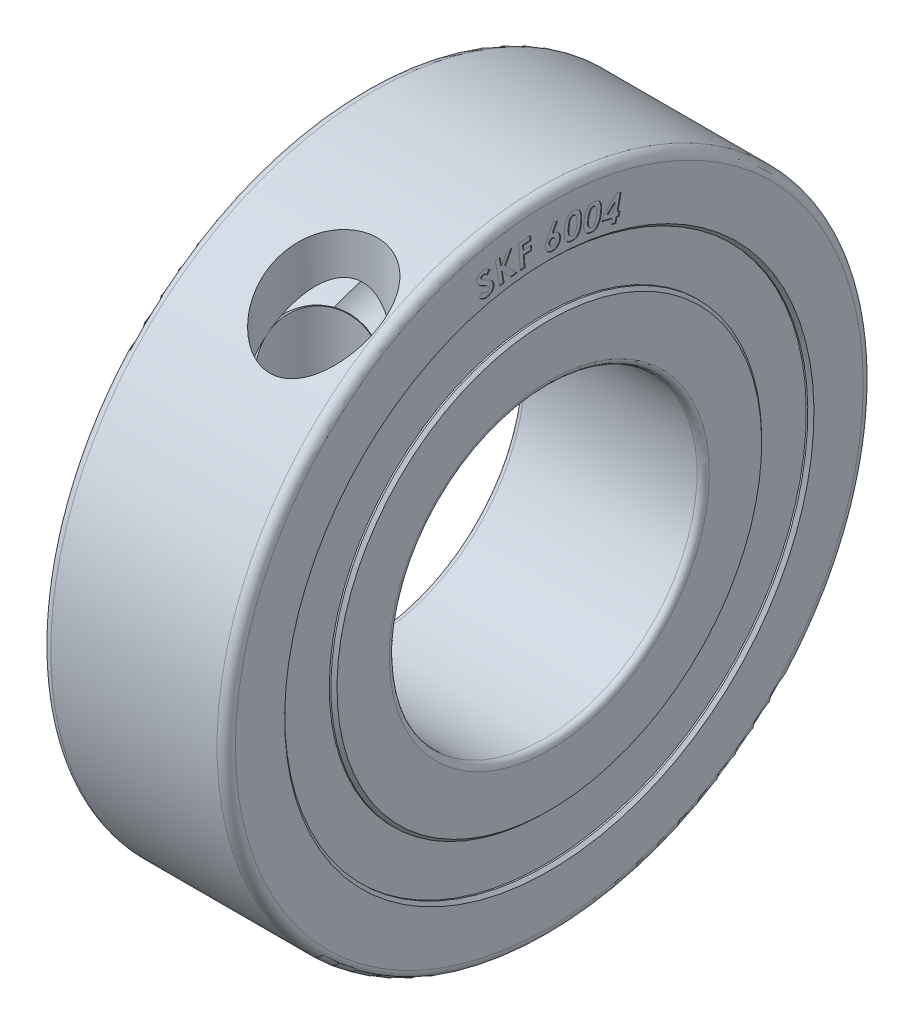
from build123d import *

# Parameters (mm, degrees)
CIRPATTERN1_COUNT  = 10
WRAP1_START        = -0.05
WRAP1_DEPTH        = 0.05
SKETCH6_R          = 17
SKETCH6_R_2        = 14
SEAL_1_DEPTH       = 0.2
SKETCH7_R          = 17
SKETCH7_R_2        = 14
SEAL_2_DEPTH       = 0.2
SKETCH10_R         = 3.500000003
CUT_EXTRUDE2_DEPTH = 80


# Read off the part's stored shape, not the designer's step: Wrap1
with BuildPart() as part:
    # Sketch1 → Revolve1 (revolve)
    with BuildSketch(Plane.XY):
        with BuildLine():
            ThreePointArc((-8.598076211, 14), (-6, 12.5), (-3.401923789, 14))
            Line((-3.401923789, 14), (-0.2, 14))
            Line((-0.2, 14), (0, 13.8))
            Line((0, 13.8), (0, 10.4))
            ThreePointArc((0, 10.4), (-0.117157288, 10.117157288), (-0.4, 10))
            Line((-0.4, 10), (-11.6, 10))
            ThreePointArc((-11.6, 10), (-11.882842712, 10.117157288), (-12, 10.4))
            Line((-12, 10.4), (-12, 13.8))
            Line((-12, 13.8), (-11.8, 14))
            Line((-11.8, 14), (-8.598076211, 14))
        make_face()
        with BuildLine():
            ThreePointArc((-12, 20.4), (-11.824264069, 20.824264069), (-11.4, 21))
            Line((-11.4, 21), (-0.6, 21))
            ThreePointArc((-0.6, 21), (-0.175735931, 20.824264069), (0, 20.4))
            Line((0, 20.4), (0, 17.2))
            Line((0, 17.2), (-0.2, 17))
            Line((-0.2, 17), (-3.401923789, 17))
            ThreePointArc((-3.401923789, 17), (-6, 18.5), (-8.598076211, 17))
            Line((-8.598076211, 17), (-11.8, 17))
            Line((-11.8, 17), (-12, 17.2))
            Line((-12, 17.2), (-12, 20.4))
        make_face()
    revolve(axis=Axis((0, 0, 0), (-1, 0, 0)))

    # Wrap1 outline → Wrap1 (cut)
    # profile 1 of 7: a face of its own
    with BuildSketch(Plane(origin=(0, 0, 0), x_dir=(0, 0, -1), z_dir=(1, 0, 0)).offset(WRAP1_START)):
        with BuildLine():
            add(Edge.make_bspline(
                [(3.371230073, 18.099908799), (3.367021792, 18.074450646), (3.358845885, 18.024990187), (3.344100531, 17.953462082), (3.327675767, 17.886692452), (3.310287168, 17.824463326), (3.291023357, 17.76706186), (3.270562573, 17.714251275), (3.248651952, 17.666050883), (3.224600442, 17.622647963), (3.200020082, 17.582877045), (3.173672712, 17.546918509), (3.147123316, 17.513492758), (3.118931042, 17.483621607), (3.090310833, 17.456494062), (3.060045379, 17.433023031), (3.029231176, 17.412018677), (2.9967952, 17.394666952), (2.963356804, 17.380162765), (2.92851016, 17.368545), (2.892249335, 17.359943276), (2.854416962, 17.354143708), (2.815081223, 17.351301149), (2.774190372, 17.351515165), (2.731850469, 17.353773642), (2.703363248, 17.358008783), (2.688858278, 17.360165209)],
                knots=[0, 0, 0, 0, 0.06771507, 0.131557793, 0.191605808, 0.24814466, 0.301078439, 0.350439304, 0.396733745, 0.439899694, 0.480587711, 0.519343045, 0.556826925, 0.592534191, 0.627052559, 0.660202326, 0.692941642, 0.724807233, 0.756580172, 0.788499994, 0.821075612, 0.854266855, 0.888846663, 0.924455818, 0.96153482, 1, 1, 1, 1], degree=3))
            add(Edge.make_bspline(
                [(2.945589047, 19.017216491), (2.959740171, 19.014769669), (2.987509021, 19.009968252), (3.027771436, 18.999031871), (3.066267586, 18.98652646), (3.102652231, 18.970840473), (3.137407792, 18.953359805), (3.170073744, 18.933141236), (3.200793446, 18.910476097), (3.229585385, 18.885575603), (3.256452955, 18.858079923), (3.281060855, 18.82808068), (3.303212811, 18.795332489), (3.323587507, 18.760469683), (3.341019583, 18.722644074), (3.356875377, 18.682722618), (3.369869534, 18.639983587), (3.381209546, 18.594794272), (3.389970077, 18.546204418), (3.395472187, 18.493930855), (3.398720388, 18.437776925), (3.398909178, 18.37776587), (3.396257572, 18.313824388), (3.390736346, 18.24594039), (3.382340924, 18.174125334), (3.375001883, 18.125103154), (3.371230073, 18.099908799)],
                knots=[0, 0, 0, 0, 0.037515201, 0.073616341, 0.108937968, 0.143221105, 0.177064726, 0.210542334, 0.243494071, 0.276750842, 0.309925447, 0.343856508, 0.378013179, 0.413168846, 0.449269985, 0.486761276, 0.525358336, 0.565926344, 0.60848579, 0.65427892, 0.703225985, 0.755444982, 0.811059021, 0.870448349, 0.933418499, 1, 1, 1, 1], degree=3))
            add(Edge.make_bspline(
                [(2.496550585, 18.869780594), (2.511904799, 18.884820046), (2.54196111, 18.914260201), (2.592272883, 18.950876921), (2.644728086, 18.980794925), (2.700034823, 19.003077589), (2.757908698, 19.017968897), (2.818434768, 19.025100066), (2.881511985, 19.02573228), (2.923940727, 19.020093535), (2.945589047, 19.017216491)],
                knots=[0, 0, 0, 0, 0.13062355, 0.25569931, 0.377370497, 0.497237959, 0.617378322, 0.73985433, 0.867266468, 1, 1, 1, 1], degree=3))
            add(Edge.make_bspline(
                [(2.261935201, 18.261767773), (2.267913747, 18.296659865), (2.279443406, 18.36394946), (2.301371478, 18.460298368), (2.325733324, 18.548707562), (2.353636925, 18.628970664), (2.384037943, 18.701454074), (2.418211668, 18.765467486), (2.454529946, 18.822015713), (2.482908489, 18.854273617), (2.496550585, 18.869780594)],
                knots=[0, 0, 0, 0, 0.160750525, 0.310008292, 0.448575007, 0.577014696, 0.695710594, 0.805112842, 0.906314099, 1, 1, 1, 1], degree=3))
            add(Edge.make_bspline(
                [(2.688858278, 17.360165209), (2.674398915, 17.362766288), (2.645935262, 17.367886582), (2.604688734, 17.378439473), (2.565641757, 17.391381705), (2.528642479, 17.406270264), (2.494086771, 17.424067653), (2.461367669, 17.443642402), (2.430949786, 17.465667383), (2.402948684, 17.490329148), (2.376750031, 17.516899164), (2.353148256, 17.546308877), (2.33109988, 17.577729578), (2.311719339, 17.612054475), (2.293591406, 17.648356351), (2.278397802, 17.687422163), (2.264883657, 17.728604311), (2.253187723, 17.77240871), (2.244172575, 17.819620095), (2.238189507, 17.87071104), (2.235226074, 17.925933062), (2.23441464, 17.985192468), (2.237388884, 18.048583582), (2.242290312, 18.116075511), (2.250888153, 18.187652297), (2.258179738, 18.236572093), (2.261935201, 18.261767773)],
                knots=[0, 0, 0, 0, 0.038840046, 0.076457701, 0.112461119, 0.147558653, 0.18179863, 0.215132686, 0.248303527, 0.280939506, 0.313703624, 0.346839559, 0.380537958, 0.415088877, 0.450971274, 0.487746736, 0.525805242, 0.565550214, 0.607548685, 0.652787717, 0.701461887, 0.753729716, 0.809430509, 0.869211738, 0.932638737, 1, 1, 1, 1], degree=3))
        make_face()
        with BuildLine():
            add(Edge.make_bspline(
                [(2.560973662, 18.207601107), (2.55722818, 18.183591837), (2.55003775, 18.137499774), (2.543190741, 18.070731306), (2.538756312, 18.009488354), (2.537625385, 17.953625995), (2.539847826, 17.903211609), (2.544600245, 17.858006135), (2.553109689, 17.818241148), (2.564811559, 17.783579123), (2.578994779, 17.753391663), (2.595527488, 17.727047089), (2.613358453, 17.703637369), (2.633512942, 17.683910786), (2.655372808, 17.667283823), (2.679381127, 17.654562816), (2.705018666, 17.644470059), (2.723179696, 17.641068058), (2.732448021, 17.639331876)],
                knots=[0, 0, 0, 0, 0.11048341, 0.212101753, 0.305111828, 0.389660501, 0.466013113, 0.534473427, 0.596129147, 0.650517161, 0.700502016, 0.747417632, 0.791733032, 0.833989916, 0.875286291, 0.916154624, 0.957210235, 1, 1, 1, 1], degree=3))
            add(Edge.make_bspline(
                [(2.907448021, 18.731319055), (2.894964081, 18.732735738), (2.870401693, 18.735523089), (2.833372658, 18.731784978), (2.797826868, 18.721203827), (2.76937118, 18.707672013), (2.747556151, 18.693256505), (2.731752717, 18.679714116), (2.716100269, 18.664253396), (2.701416517, 18.646045889), (2.687027584, 18.625619461), (2.673324639, 18.602692161), (2.659840379, 18.577724589), (2.64683592, 18.550186274), (2.634802884, 18.519589276), (2.622871741, 18.48572158), (2.611279712, 18.448229827), (2.600785076, 18.406918191), (2.589440149, 18.362317842), (2.580008866, 18.313834182), (2.569754695, 18.26200592), (2.563960116, 18.226104336), (2.560973662, 18.207601107)],
                knots=[0, 0, 0, 0, 0.053807152, 0.105866591, 0.158396439, 0.212334335, 0.240439985, 0.270382042, 0.301508468, 0.334738855, 0.37061322, 0.408674434, 0.449295614, 0.49237112, 0.539287623, 0.590335628, 0.64646645, 0.70763757, 0.773253033, 0.843935961, 0.919566535, 1, 1, 1, 1], degree=3))
            add(Edge.make_bspline(
                [(3.071871098, 18.144460081), (3.075684523, 18.169328645), (3.08301762, 18.217150114), (3.090678084, 18.286327778), (3.095392758, 18.349945426), (3.096631485, 18.407812309), (3.095472971, 18.460088149), (3.090298234, 18.506580948), (3.082619946, 18.547678003), (3.071379185, 18.583361008), (3.057208649, 18.614283936), (3.041695788, 18.641546984), (3.024196126, 18.665472244), (3.004599818, 18.685634127), (2.983229783, 18.702798813), (2.959564932, 18.715725476), (2.934407127, 18.726202463), (2.916511124, 18.729598961), (2.907448021, 18.731319055)],
                knots=[0, 0, 0, 0, 0.111921973, 0.21522245, 0.309570358, 0.395623902, 0.472662068, 0.542001484, 0.603525321, 0.65839315, 0.707958574, 0.754593049, 0.797752856, 0.839434739, 0.879372757, 0.919169101, 0.959064669, 1, 1, 1, 1], degree=3))
            add(Edge.make_bspline(
                [(2.923473662, 17.719460081), (2.931745653, 17.730072864), (2.94915253, 17.752405505), (2.97116286, 17.791330103), (2.99197335, 17.835854085), (3.011507892, 17.886139473), (3.028801764, 17.942494273), (3.045333601, 18.004425744), (3.059477642, 18.072443833), (3.067637857, 18.119861441), (3.071871098, 18.144460081)],
                knots=[0, 0, 0, 0, 0.088647822, 0.186542965, 0.294033778, 0.412723239, 0.541986475, 0.682654909, 0.835372178, 1, 1, 1, 1], degree=3))
            add(Edge.make_bspline(
                [(2.732448021, 17.639331876), (2.741408215, 17.638222221), (2.758975574, 17.63604663), (2.785305096, 17.6371819), (2.810839087, 17.641522682), (2.835391637, 17.650082494), (2.85901233, 17.662040721), (2.881563278, 17.677759743), (2.903633717, 17.696659594), (2.916714474, 17.711692278), (2.923473662, 17.719460081)],
                knots=[0, 0, 0, 0, 0.124271779, 0.243647278, 0.36180831, 0.480106935, 0.600639691, 0.725642384, 0.858231852, 1, 1, 1, 1], degree=3))
        make_face(mode=Mode.SUBTRACT)
    # profile 2 of 7: a face of its own
    with BuildSketch(Plane(origin=(0, 0, 0), x_dir=(0, 0, -1), z_dir=(1, 0, 0)).offset(WRAP1_START)):
        with BuildLine():
            add(Edge.make_bspline(
                [(2.095342211, 18.297444026), (2.09291739, 18.27178867), (2.088201899, 18.221897314), (2.079035438, 18.149492619), (2.067695358, 18.081646292), (2.055127245, 18.018273359), (2.040452476, 17.959519487), (2.023753498, 17.905378374), (2.005319152, 17.855790432), (1.98502908, 17.810518082), (1.962959724, 17.76928126), (1.940043214, 17.731054821), (1.915612255, 17.696139217), (1.890262865, 17.664013872), (1.863230797, 17.635329769), (1.835420807, 17.608972218), (1.805757408, 17.586378476), (1.77515845, 17.566180503), (1.742939362, 17.549178878), (1.709074408, 17.5349231), (1.673379767, 17.523874559), (1.636135795, 17.515087655), (1.597092063, 17.509459669), (1.556414384, 17.506228156), (1.513883244, 17.50586), (1.485077179, 17.507925789), (1.470342211, 17.508982488)],
                knots=[0, 0, 0, 0, 0.067634643, 0.131527465, 0.19150296, 0.248146273, 0.301058101, 0.350372437, 0.396779637, 0.439829112, 0.480472474, 0.519474004, 0.556735109, 0.592251312, 0.626772806, 0.660105342, 0.692692356, 0.724502796, 0.756238993, 0.788162936, 0.820799379, 0.854196724, 0.888500003, 0.924222611, 0.961238115, 1, 1, 1, 1], degree=3))
            add(Edge.make_bspline(
                [(1.601752468, 19.181097872), (1.615994103, 19.179727766), (1.644092972, 19.177024535), (1.685131719, 19.169004114), (1.72460147, 19.159257331), (1.762315833, 19.146833481), (1.79793309, 19.131204616), (1.832095943, 19.113621008), (1.864535147, 19.09344593), (1.895072154, 19.070468776), (1.924115468, 19.045282075), (1.950649195, 19.016807537), (1.975458979, 18.986064521), (1.99786595, 18.9524849), (2.018511911, 18.916432893), (2.036971867, 18.877584771), (2.053766418, 18.83612491), (2.068171703, 18.791668823), (2.080378947, 18.743826746), (2.090380366, 18.692273775), (2.097152413, 18.636460305), (2.101985625, 18.576693197), (2.104156767, 18.512630722), (2.103609111, 18.444540812), (2.101298812, 18.372255445), (2.097365808, 18.322859212), (2.095342211, 18.297444026)],
                knots=[0, 0, 0, 0, 0.03735056, 0.073692972, 0.109090982, 0.143507382, 0.177255438, 0.210580872, 0.243799811, 0.276896621, 0.310315398, 0.344072683, 0.378415464, 0.413399656, 0.449397582, 0.486842889, 0.525656602, 0.566162923, 0.608803755, 0.654558023, 0.703224562, 0.755576787, 0.811144487, 0.870585365, 0.93341401, 1, 1, 1, 1], degree=3))
            add(Edge.make_bspline(
                [(1.165214006, 18.999687616), (1.179369198, 19.015864951), (1.207105955, 19.047564049), (1.254417581, 19.088141221), (1.304665172, 19.121732705), (1.357983235, 19.148460584), (1.414710953, 19.167273505), (1.47438275, 19.179620528), (1.537288743, 19.184386081), (1.579961607, 19.182209395), (1.601752468, 19.181097872)],
                knots=[0, 0, 0, 0, 0.130620006, 0.255946758, 0.377787921, 0.497526061, 0.617540752, 0.740274638, 0.867371473, 1, 1, 1, 1], degree=3))
            add(Edge.make_bspline(
                [(0.976431955, 18.375969667), (0.979714821, 18.411159795), (0.986059186, 18.479167159), (1.000908033, 18.57691839), (1.018993788, 18.666938967), (1.040598245, 18.749110441), (1.065736792, 18.823461978), (1.094591467, 18.889914616), (1.126791338, 18.94888655), (1.152733277, 18.983186045), (1.165214006, 18.999687616)],
                knots=[0, 0, 0, 0, 0.160494637, 0.31016702, 0.448821292, 0.57735073, 0.695815233, 0.804898528, 0.906136206, 1, 1, 1, 1], degree=3))
            add(Edge.make_bspline(
                [(1.470342211, 17.508982488), (1.455682424, 17.510514806), (1.426991218, 17.513513763), (1.385003119, 17.520949134), (1.345075793, 17.53084798), (1.306998371, 17.54300862), (1.271034775, 17.557688308), (1.237129061, 17.575207375), (1.205148008, 17.594973282), (1.175103307, 17.617245754), (1.1471017, 17.642009337), (1.121113676, 17.669488749), (1.096614586, 17.699178949), (1.074602156, 17.731909744), (1.053906178, 17.766736567), (1.035808539, 17.804542699), (1.019070783, 17.844606297), (1.004176421, 17.887571271), (0.99161335, 17.934015629), (0.981806569, 17.98447334), (0.974472351, 18.039268408), (0.969828846, 18.09832764), (0.967604656, 18.161742717), (0.968171162, 18.229300899), (0.970485277, 18.301264483), (0.974408851, 18.350554409), (0.976431955, 18.375969667)],
                knots=[0, 0, 0, 0, 0.038949878, 0.07623023, 0.112597827, 0.147604629, 0.181795547, 0.215137477, 0.248363209, 0.281063993, 0.313871897, 0.347027956, 0.380943726, 0.415485019, 0.451178704, 0.487930185, 0.526160964, 0.565901269, 0.608029874, 0.653220521, 0.701663576, 0.7540765, 0.809741728, 0.869325926, 0.932620807, 1, 1, 1, 1], degree=3))
        make_face()
        with BuildLine():
            add(Edge.make_bspline(
                [(1.278996058, 18.344238898), (1.277224785, 18.320103253), (1.273818157, 18.273683988), (1.271607313, 18.206650494), (1.271679586, 18.145264564), (1.274771084, 18.089391782), (1.28073669, 18.039281684), (1.289163788, 17.99460862), (1.300616301, 17.955609833), (1.314689063, 17.921814575), (1.331412309, 17.892959551), (1.349410162, 17.867598703), (1.369171758, 17.845801079), (1.390714267, 17.827483734), (1.413711076, 17.812624998), (1.438632685, 17.801655377), (1.465005467, 17.793713493), (1.483431098, 17.791510357), (1.492778109, 17.790392744)],
                knots=[0, 0, 0, 0, 0.110050834, 0.211657022, 0.304947548, 0.38914537, 0.465985354, 0.534308319, 0.595646897, 0.650514953, 0.70035513, 0.747009881, 0.791721547, 0.833777677, 0.875291416, 0.915745251, 0.95725899, 1, 1, 1, 1], degree=3))
            add(Edge.make_bspline(
                [(1.585406314, 18.892636334), (1.572892944, 18.89305767), (1.548124364, 18.89389165), (1.511373089, 18.887741983), (1.476665024, 18.874393928), (1.449218401, 18.858893772), (1.428830779, 18.84257319), (1.413612411, 18.828248461), (1.39975758, 18.811043682), (1.386043483, 18.792022818), (1.373406454, 18.770465042), (1.361120067, 18.746792883), (1.350133852, 18.720593844), (1.338939308, 18.692334175), (1.329115948, 18.660903341), (1.319782631, 18.626159584), (1.311324878, 18.587842051), (1.303126043, 18.545991153), (1.296447361, 18.500582703), (1.289429997, 18.451709311), (1.283852546, 18.399199719), (1.280648568, 18.36294034), (1.278996058, 18.344238898)],
                knots=[0, 0, 0, 0, 0.05362201, 0.106137761, 0.158491276, 0.212495803, 0.240553822, 0.27037554, 0.301945594, 0.335137331, 0.370900023, 0.40902506, 0.449465365, 0.492702034, 0.53937298, 0.590623594, 0.64699545, 0.70766716, 0.773523293, 0.843847779, 0.919461618, 1, 1, 1, 1], degree=3))
            add(Edge.make_bspline(
                [(1.793098622, 18.319559411), (1.794974187, 18.344656333), (1.798578832, 18.39289004), (1.801117367, 18.462485113), (1.801350231, 18.526215222), (1.798619773, 18.584115386), (1.792924081, 18.636030621), (1.784860698, 18.682193168), (1.773753508, 18.722477167), (1.759957285, 18.757316653), (1.743551568, 18.787126973), (1.726081932, 18.813304385), (1.706666833, 18.835673023), (1.685713524, 18.854484162), (1.663010526, 18.869827551), (1.638590939, 18.881363293), (1.612539513, 18.889296061), (1.594538005, 18.891512163), (1.585406314, 18.892636334)],
                knots=[0, 0, 0, 0, 0.111925396, 0.215109112, 0.309669572, 0.395308495, 0.472761083, 0.541825581, 0.603507297, 0.658303399, 0.70805889, 0.754582693, 0.798032276, 0.839427361, 0.879491956, 0.919452154, 0.959140201, 1, 1, 1, 1], degree=3))
            add(Edge.make_bspline(
                [(1.677393493, 17.884944026), (1.684794236, 17.896233375), (1.700296021, 17.919880336), (1.719719034, 17.960151403), (1.736730981, 18.006079098), (1.752147333, 18.057684045), (1.765377767, 18.114988823), (1.776858766, 18.178094761), (1.786512354, 18.246839817), (1.790851621, 18.29475007), (1.793098622, 18.319559411)],
                knots=[0, 0, 0, 0, 0.089049784, 0.186525971, 0.294345853, 0.412174039, 0.541864021, 0.682428905, 0.835552332, 1, 1, 1, 1], degree=3))
            add(Edge.make_bspline(
                [(1.492778109, 17.790392744), (1.501759263, 17.789888941), (1.519464092, 17.78889578), (1.545555148, 17.7924326), (1.570590625, 17.798803251), (1.594592653, 17.808741113), (1.617040131, 17.822926205), (1.638834664, 17.839920119), (1.658954917, 17.861025093), (1.671127121, 17.876815148), (1.677393493, 17.884944026)],
                knots=[0, 0, 0, 0, 0.12364208, 0.243739497, 0.360805692, 0.478866487, 0.599754619, 0.725463477, 0.858665841, 1, 1, 1, 1], degree=3))
        make_face(mode=Mode.SUBTRACT)
    # profile 3 of 7: a face of its own
    with BuildSketch(Plane(origin=(0, 0, 0), x_dir=(0, 0, -1), z_dir=(1, 0, 0)).offset(WRAP1_START)):
        with BuildLine():
            add(Edge.make_bspline(
                [(0.247749873, 18.572715831), (0.264337421, 18.572090536), (0.296926565, 18.570862035), (0.344820026, 18.563259573), (0.390697017, 18.551315349), (0.435027206, 18.535550411), (0.476745201, 18.513951528), (0.516801872, 18.488481744), (0.555047326, 18.45867384), (0.590567377, 18.424347003), (0.62356237, 18.387413872), (0.651828913, 18.347244078), (0.676091853, 18.305172276), (0.695630749, 18.260759778), (0.710835616, 18.214283333), (0.721329904, 18.165633482), (0.727601775, 18.114763993), (0.727997238, 18.080105847), (0.728198591, 18.062459421)],
                knots=[0, 0, 0, 0, 0.063700778, 0.125151336, 0.185753709, 0.245588764, 0.30540553, 0.365728104, 0.427692868, 0.491244168, 0.555198125, 0.617582535, 0.679514692, 0.741418303, 0.803566165, 0.866980907, 0.932272443, 1, 1, 1, 1], degree=3))
            Line((0.247749873, 18.572715831), (0.531403719, 19.110856857))
            Line((0.531403719, 19.110856857), (0.275313975, 19.242267113))
            Line((0.275313975, 19.242267113), (-0.141993717, 18.445792754))
            add(Edge.make_bspline(
                [(-0.270198845, 18.069510703), (-0.269857774, 18.081808834), (-0.269170498, 18.106590262), (-0.264593868, 18.143685004), (-0.25697304, 18.18076282), (-0.248911875, 18.21213646), (-0.239786099, 18.23840267), (-0.231650945, 18.260907659), (-0.220764999, 18.285493855), (-0.208616432, 18.312748214), (-0.194915959, 18.342704076), (-0.178780135, 18.374817398), (-0.161173639, 18.409607388), (-0.148551525, 18.433420614), (-0.141993717, 18.445792754)],
                knots=[0, 0, 0, 0, 0.091812954, 0.185008287, 0.278551124, 0.374322003, 0.426534136, 0.486094508, 0.552913929, 0.627178303, 0.708902245, 0.798792991, 0.895463084, 1, 1, 1, 1], degree=3))
            add(Edge.make_bspline(
                [(0.226596027, 17.571113267), (0.209045321, 17.571717578), (0.174417747, 17.572909884), (0.123761703, 17.580835325), (0.075338513, 17.592991743), (0.029193911, 17.609699437), (-0.01462895, 17.631191931), (-0.055833114, 17.657908362), (-0.095178353, 17.688611065), (-0.13125384, 17.724067158), (-0.163919317, 17.762312793), (-0.193187926, 17.801975517), (-0.217011577, 17.843604474), (-0.237369544, 17.886038354), (-0.252307696, 17.930110527), (-0.262876061, 17.975410978), (-0.269675151, 18.021973319), (-0.270023216, 18.053568272), (-0.270198845, 18.069510703)],
                knots=[0, 0, 0, 0, 0.067328577, 0.1328394, 0.196270313, 0.258644694, 0.320792365, 0.383106101, 0.446743311, 0.511967507, 0.576793738, 0.639601694, 0.700769614, 0.760550994, 0.8199234, 0.878885421, 0.938887048, 1, 1, 1, 1], degree=3))
            add(Edge.make_bspline(
                [(0.728198591, 18.062459421), (0.727578074, 18.045443245), (0.726358566, 18.012001152), (0.71868307, 17.962861084), (0.707060598, 17.91575885), (0.69037213, 17.87074517), (0.669695811, 17.827580374), (0.643658564, 17.786849076), (0.613766324, 17.747694951), (0.579437603, 17.71138), (0.542081239, 17.678182342), (0.502705634, 17.648769918), (0.461050795, 17.624295532), (0.417644498, 17.604410502), (0.372507767, 17.588736241), (0.325366241, 17.578458155), (0.276585698, 17.571614567), (0.243393615, 17.571281715), (0.226596027, 17.571113267)],
                knots=[0, 0, 0, 0, 0.065323678, 0.128381405, 0.190559154, 0.251291348, 0.312381252, 0.373948514, 0.436546971, 0.501258641, 0.565469168, 0.628228685, 0.689642719, 0.750578196, 0.811285451, 0.872683046, 0.935568438, 1, 1, 1, 1], degree=3))
        make_face()
        with BuildLine():
            add(Edge.make_bspline(
                [(0.026275514, 18.074318395), (0.026751649, 18.05950124), (0.02768021, 18.030604715), (0.039022168, 17.989201734), (0.057674379, 17.951377467), (0.0835563, 17.918223936), (0.114121297, 17.890518551), (0.148247446, 17.869990007), (0.185231038, 17.857210438), (0.21100601, 17.855374453), (0.224031924, 17.8544466)],
                knots=[0, 0, 0, 0, 0.135224471, 0.263715746, 0.389156449, 0.518761666, 0.646106758, 0.764439774, 0.880954771, 1, 1, 1, 1], degree=3))
            add(Edge.make_bspline(
                [(0.227557565, 18.28617737), (0.213897194, 18.285741014), (0.187244271, 18.284889635), (0.149196063, 18.272897524), (0.114307589, 18.254035543), (0.08402332, 18.227330504), (0.058467168, 18.195365365), (0.039935812, 18.158494295), (0.028843604, 18.117573452), (0.027148619, 18.089024347), (0.026275514, 18.074318395)],
                knots=[0, 0, 0, 0, 0.125207775, 0.244294468, 0.363052186, 0.48778071, 0.613034767, 0.737425939, 0.864745266, 1, 1, 1, 1], degree=3))
            add(Edge.make_bspline(
                [(0.431724232, 18.070151729), (0.431231364, 18.084962576), (0.430277971, 18.113612393), (0.419333686, 18.154791097), (0.40070284, 18.191826243), (0.375404591, 18.224568115), (0.344398875, 18.251416303), (0.309017924, 18.271602294), (0.269466579, 18.283794914), (0.241745013, 18.285370838), (0.227557565, 18.28617737)],
                knots=[0, 0, 0, 0, 0.133600665, 0.258434547, 0.381504528, 0.506080469, 0.629980993, 0.749749056, 0.87192563, 1, 1, 1, 1], degree=3))
            add(Edge.make_bspline(
                [(0.224031924, 17.8544466), (0.237682948, 17.85504221), (0.26451443, 17.856212899), (0.303186995, 17.868003243), (0.338794, 17.887335017), (0.370582745, 17.913982621), (0.39762591, 17.946322916), (0.416994863, 17.984010428), (0.429475728, 18.025678957), (0.430957921, 18.054995003), (0.431724232, 18.070151729)],
                knots=[0, 0, 0, 0, 0.122550959, 0.240877457, 0.360032907, 0.484970173, 0.612001885, 0.736702204, 0.863872077, 1, 1, 1, 1], degree=3))
        make_face(mode=Mode.SUBTRACT)
    # profile 4 of 7: a face of its own
    with BuildSketch(Plane(origin=(0, 0, 0), x_dir=(0, 0, -1), z_dir=(1, 0, 0)).offset(WRAP1_START)):
        with BuildLine():
            add(Edge.make_bspline(
                [(-4.028029173, 18.350351868), (-4.040396967, 18.36077367), (-4.064126452, 18.380769475), (-4.100399702, 18.406933466), (-4.135718731, 18.428043061), (-4.17023037, 18.443894671), (-4.203719713, 18.455145751), (-4.236412405, 18.461003436), (-4.268203602, 18.462069788), (-4.288533927, 18.458298241), (-4.298541994, 18.456441611)],
                knots=[0, 0, 0, 0, 0.160850741, 0.308616513, 0.444411743, 0.569490283, 0.685779989, 0.794815753, 0.89899337, 1, 1, 1, 1], degree=3))
            Line((-4.028029173, 18.350351868), (-3.85495225, 18.592980073))
            add(Edge.make_bspline(
                [(-4.359118917, 18.739133919), (-4.339849777, 18.742929028), (-4.301564579, 18.7504694), (-4.243015773, 18.7531928), (-4.184548442, 18.748436957), (-4.13573955, 18.739237692), (-4.096204551, 18.727692036), (-4.065072172, 18.716548522), (-4.032947564, 18.702092729), (-3.999439371, 18.685685543), (-3.964987458, 18.666078468), (-3.929185037, 18.644437656), (-3.892162956, 18.619987311), (-3.867597807, 18.602158119), (-3.85495225, 18.592980073)],
                knots=[0, 0, 0, 0, 0.108281815, 0.215141445, 0.322188001, 0.431471833, 0.488574182, 0.549380289, 0.613801409, 0.682891906, 0.755227605, 0.832488319, 0.913768956, 1, 1, 1, 1], degree=3))
            add(Edge.make_bspline(
                [(-4.694054814, 18.250031355), (-4.696655171, 18.263346758), (-4.701783862, 18.28960876), (-4.7050657, 18.329252298), (-4.703750311, 18.368275776), (-4.698153641, 18.406696424), (-4.6888981, 18.444647667), (-4.67540159, 18.482119463), (-4.657065498, 18.51868153), (-4.635601806, 18.554683364), (-4.610450725, 18.588686135), (-4.582467431, 18.619939403), (-4.551857317, 18.648089791), (-4.518420408, 18.672691617), (-4.482481793, 18.694365929), (-4.443955919, 18.713068261), (-4.402541472, 18.728099319), (-4.373719064, 18.735423709), (-4.359118917, 18.739133919)],
                knots=[0, 0, 0, 0, 0.061669923, 0.121631743, 0.180456706, 0.238864801, 0.297906091, 0.357850191, 0.419564124, 0.483644693, 0.548270062, 0.611581529, 0.674172928, 0.737048463, 0.800045914, 0.86480631, 0.931516902, 1, 1, 1, 1], degree=3))
            add(Edge.make_bspline(
                [(-4.169054814, 17.800672381), (-4.193014888, 17.812688397), (-4.239059019, 17.835779604), (-4.304953862, 17.869957871), (-4.364330938, 17.902848607), (-4.417483435, 17.933994959), (-4.464380242, 17.963389795), (-4.505000277, 17.991194685), (-4.539734702, 18.016941082), (-4.576299465, 18.049475568), (-4.61409782, 18.090003524), (-4.650458735, 18.140984667), (-4.678100654, 18.194120844), (-4.68877769, 18.231537953), (-4.694054814, 18.250031355)],
                knots=[0, 0, 0, 0, 0.112633669, 0.216448392, 0.311899472, 0.397826498, 0.475299424, 0.544409833, 0.604658087, 0.656816255, 0.749894048, 0.836840039, 0.919358207, 1, 1, 1, 1], degree=3))
            add(Edge.make_bspline(
                [(-3.897580455, 17.583364688), (-3.90018471, 17.592018662), (-3.905479642, 17.609613789), (-3.918983983, 17.634659511), (-3.937719036, 17.658144992), (-3.956996607, 17.676844579), (-3.975870328, 17.691833316), (-3.993607936, 17.704389312), (-4.014878233, 17.71763445), (-4.039042262, 17.73251238), (-4.067005293, 17.747718906), (-4.097747608, 17.764836105), (-4.132324897, 17.782360034), (-4.156441177, 17.79438363), (-4.169054814, 17.800672381)],
                knots=[0, 0, 0, 0, 0.075516127, 0.153538244, 0.23637411, 0.326187651, 0.377729481, 0.438032648, 0.508000914, 0.587455494, 0.675542382, 0.774403487, 0.882005324, 1, 1, 1, 1], degree=3))
            add(Edge.make_bspline(
                [(-4.04245225, 17.395544175), (-4.030334887, 17.398862555), (-4.006856397, 17.405292216), (-3.974914094, 17.421681177), (-3.947400573, 17.442869565), (-3.924989914, 17.468401964), (-3.907537687, 17.496133643), (-3.897030033, 17.525199407), (-3.892930325, 17.55466894), (-3.896025394, 17.573768472), (-3.897580455, 17.583364688)],
                knots=[0, 0, 0, 0, 0.143345633, 0.277745155, 0.407495066, 0.538161867, 0.664289972, 0.779827598, 0.889378334, 1, 1, 1, 1], degree=3))
            add(Edge.make_bspline(
                [(-4.346298404, 17.541377509), (-4.333421244, 17.527225254), (-4.308820393, 17.500188432), (-4.269365778, 17.465522874), (-4.230796837, 17.436769224), (-4.192470265, 17.414758162), (-4.154251139, 17.399547907), (-4.116529235, 17.391051533), (-4.078866709, 17.388982141), (-4.054590708, 17.393356776), (-4.04245225, 17.395544175)],
                knots=[0, 0, 0, 0, 0.162043298, 0.309571581, 0.44430875, 0.569193757, 0.68302373, 0.791544333, 0.895768234, 1, 1, 1, 1], degree=3))
            Line((-4.346298404, 17.541377509), (-4.559118917, 17.334967252))
            add(Edge.make_bspline(
                [(-3.984118917, 17.114454432), (-3.997765546, 17.111633904), (-4.024612227, 17.106085148), (-4.064841358, 17.100442759), (-4.10439022, 17.098387112), (-4.143261997, 17.098559077), (-4.18142589, 17.10172604), (-4.218762488, 17.107991237), (-4.255429146, 17.116403322), (-4.291141283, 17.12851164), (-4.326331408, 17.143294503), (-4.361026742, 17.161354511), (-4.395227827, 17.182561166), (-4.429188535, 17.206711504), (-4.462333528, 17.234428138), (-4.495348705, 17.264840798), (-4.528009877, 17.298329458), (-4.548578046, 17.322553039), (-4.559118917, 17.334967252)],
                knots=[0, 0, 0, 0, 0.063960271, 0.125827488, 0.186247135, 0.245590355, 0.3041564, 0.361803542, 0.419258443, 0.47664004, 0.534661464, 0.594324008, 0.655978987, 0.71926067, 0.78544417, 0.854162927, 0.925260745, 1, 1, 1, 1], degree=3))
            add(Edge.make_bspline(
                [(-3.611362507, 17.662531355), (-3.608186683, 17.646874724), (-3.601959752, 17.616176305), (-3.597720997, 17.569984068), (-3.598556165, 17.525023428), (-3.602999907, 17.480980433), (-3.613314795, 17.438340526), (-3.627334958, 17.396547014), (-3.646440808, 17.356119142), (-3.6697865, 17.317190275), (-3.696899857, 17.280343461), (-3.72786053, 17.246526746), (-3.76221387, 17.215991849), (-3.800026082, 17.189011982), (-3.841045429, 17.165022978), (-3.885705811, 17.14475916), (-3.933529121, 17.127157081), (-3.967040382, 17.118742701), (-3.984118917, 17.114454432)],
                knots=[0, 0, 0, 0, 0.064431633, 0.126333004, 0.18669302, 0.245678011, 0.304551045, 0.363308745, 0.423287304, 0.484577694, 0.546226356, 0.607559182, 0.669244009, 0.731335733, 0.794701418, 0.860670832, 0.928992881, 1, 1, 1, 1], degree=3))
            add(Edge.make_bspline(
                [(-3.856554814, 17.97791597), (-3.839171925, 17.966419518), (-3.805861506, 17.944389138), (-3.760746827, 17.908581248), (-3.721931971, 17.872612662), (-3.689874879, 17.835096352), (-3.663537915, 17.795785732), (-3.641149446, 17.754438185), (-3.623762761, 17.709655563), (-3.615547198, 17.678434278), (-3.611362507, 17.662531355)],
                knots=[0, 0, 0, 0, 0.152017018, 0.291306616, 0.419810801, 0.537604995, 0.650477052, 0.764530291, 0.880060779, 1, 1, 1, 1], degree=3))
            add(Edge.make_bspline(
                [(-4.101747122, 18.108685201), (-4.085826024, 18.100570255), (-4.055558359, 18.0851429), (-4.012638054, 18.063176009), (-3.974871244, 18.043104517), (-3.941641107, 18.025991086), (-3.913611174, 18.010490144), (-3.890132729, 17.997714782), (-3.871522489, 17.987338662), (-3.861021543, 17.980727937), (-3.856554814, 17.97791597)],
                knots=[0, 0, 0, 0, 0.192880486, 0.366685863, 0.520397587, 0.654506103, 0.770098037, 0.866087376, 0.943038341, 1, 1, 1, 1], degree=3))
            add(Edge.make_bspline(
                [(-4.363285584, 18.25740315), (-4.358630051, 18.253813369), (-4.347799996, 18.245462548), (-4.327955069, 18.232920688), (-4.303211419, 18.217497086), (-4.272820006, 18.200409696), (-4.237770594, 18.180380111), (-4.197085355, 18.158717034), (-4.151363995, 18.134252896), (-4.118865591, 18.11750639), (-4.101747122, 18.108685201)],
                knots=[0, 0, 0, 0, 0.058537166, 0.136173609, 0.233649725, 0.349028226, 0.48341844, 0.635804743, 0.80816088, 1, 1, 1, 1], degree=3))
            add(Edge.make_bspline(
                [(-4.406875327, 18.325351868), (-4.405108071, 18.318941053), (-4.401554572, 18.306050544), (-4.391376137, 18.288549413), (-4.379270943, 18.271595234), (-4.368728857, 18.262235784), (-4.363285584, 18.25740315)],
                knots=[0, 0, 0, 0, 0.242000666, 0.486601375, 0.734913053, 1, 1, 1, 1], degree=3))
            add(Edge.make_bspline(
                [(-4.298541994, 18.456441611), (-4.30773705, 18.453978949), (-4.325351994, 18.449261234), (-4.349208567, 18.437323695), (-4.36993983, 18.422586452), (-4.38617477, 18.404305628), (-4.398949314, 18.385075665), (-4.406428757, 18.365013826), (-4.409854869, 18.344925781), (-4.407866535, 18.331863545), (-4.406875327, 18.325351868)],
                knots=[0, 0, 0, 0, 0.151687296, 0.290586935, 0.423705452, 0.555372203, 0.678926168, 0.79017684, 0.895400701, 1, 1, 1, 1], degree=3))
        make_face()
    # profile 5 of 7: a face of its own
    with BuildSketch(Plane(origin=(0, 0, 0), x_dir=(0, 0, -1), z_dir=(1, 0, 0)).offset(WRAP1_START)):
        Polygon((4.455965764, 17.683734642), (4.673273456, 18.68918336), (4.376158072, 18.753285924), (3.483529866, 17.893991052), (3.423914482, 17.618991052), (4.105645251, 17.471555155), (4.036414482, 17.151042334), (4.32711961, 17.088221821), (4.396350379, 17.408734642), (4.535452943, 17.378606437), (4.595068328, 17.653606437), align=None)
        Polygon((3.808529866, 17.823798744), (4.278401661, 18.269952591), (4.165260636, 17.746555155), align=None, mode=Mode.SUBTRACT)
    # profile 6 of 7: a face of its own
    with BuildSketch(Plane(origin=(0, 0, 0), x_dir=(0, 0, -1), z_dir=(1, 0, 0)).offset(WRAP1_START)):
        Polygon((-1.196381568, 18.882215642), (-1.222022593, 19.177728463), (-2.01144567, 19.108818206), (-1.872343106, 17.517472052), (-1.572984132, 17.543433591), (-1.635484132, 18.259459232), (-1.145420029, 18.30240795), (-1.171061055, 18.593433591), (-1.661125157, 18.550484873), (-1.68644567, 18.839266924), align=None)
    # profile 7 of 7: a face of its own
    with BuildSketch(Plane(origin=(0, 0, 0), x_dir=(0, 0, -1), z_dir=(1, 0, 0)).offset(WRAP1_START)):
        Polygon((-3.113096824, 18.39495327), (-3.205725029, 18.932132757), (-3.506366055, 18.88020968), (-3.236814773, 17.318350706), (-2.936173747, 17.370273783), (-3.056045542, 18.063543013), (-2.454442978, 17.453607116), (-2.101878875, 17.514504552), (-2.849955798, 18.276363526), (-2.424314773, 19.067068654), (-2.782327593, 19.00520968), align=None)
    extrude(amount=WRAP1_DEPTH, mode=Mode.SUBTRACT)


with BuildPart() as body_2:
    # Sketch3 → Revolve3 (revolve)
    with BuildSketch(Plane.XY):
        with BuildLine():
            Line((-6, 18.5), (-6, 12.5))
            ThreePointArc((-6, 12.5), (-3, 15.5), (-6, 18.5))
        make_face()
    revolve(axis=Axis((-6, 18.5, 0), (0, -1, 0)))


with BuildPart() as cirpattern1_1:
    # CirPattern1: pattern copy
    add(body_2.part.rotate(Axis((0, 0, 0), (1, 0, 0)), 1 * 360 / CIRPATTERN1_COUNT))


with BuildPart() as cirpattern1_2:
    # CirPattern1: pattern copy
    add(body_2.part.rotate(Axis((0, 0, 0), (1, 0, 0)), 2 * 360 / CIRPATTERN1_COUNT))


with BuildPart() as cirpattern1_3:
    # CirPattern1: pattern copy
    add(body_2.part.rotate(Axis((0, 0, 0), (1, 0, 0)), 3 * 360 / CIRPATTERN1_COUNT))


with BuildPart() as cirpattern1_4:
    # CirPattern1: pattern copy
    add(body_2.part.rotate(Axis((0, 0, 0), (1, 0, 0)), 4 * 360 / CIRPATTERN1_COUNT))


with BuildPart() as cirpattern1_5:
    # CirPattern1: pattern copy
    add(body_2.part.rotate(Axis((0, 0, 0), (1, 0, 0)), 5 * 360 / CIRPATTERN1_COUNT))


with BuildPart() as cirpattern1_6:
    # CirPattern1: pattern copy
    add(body_2.part.rotate(Axis((0, 0, 0), (1, 0, 0)), 6 * 360 / CIRPATTERN1_COUNT))


with BuildPart() as cirpattern1_7:
    # CirPattern1: pattern copy
    add(body_2.part.rotate(Axis((0, 0, 0), (1, 0, 0)), 7 * 360 / CIRPATTERN1_COUNT))


with BuildPart() as cirpattern1_8:
    # CirPattern1: pattern copy
    add(body_2.part.rotate(Axis((0, 0, 0), (1, 0, 0)), 8 * 360 / CIRPATTERN1_COUNT))


with BuildPart() as cirpattern1_9:
    # CirPattern1: pattern copy
    add(body_2.part.rotate(Axis((0, 0, 0), (1, 0, 0)), 9 * 360 / CIRPATTERN1_COUNT))


with BuildPart() as body_12:
    # Sketch6 → Seal 1 (new body)
    with BuildSketch(Plane(origin=(-0.5, 0, 0), x_dir=(0, 0, -1), z_dir=(1, 0, 0))):
        with Locations(Location((0, 0, 0), (0, 0, 90))):
            Circle(SKETCH6_R)
        with Locations(Location((0, 0, 0), (0, 0, 90))):
            Circle(SKETCH6_R_2, mode=Mode.SUBTRACT)
    extrude(amount=SEAL_1_DEPTH)


with BuildPart() as body_13:
    # Sketch7 → Seal 2 (new body)
    with BuildSketch(Plane.ZY.offset(11.5)):
        with Locations(Location((0, 0, 0), (0, 0, 270))):
            Circle(SKETCH7_R)
        with Locations(Location((0, 0, 0), (0, 0, 270))):
            Circle(SKETCH7_R_2, mode=Mode.SUBTRACT)
    extrude(amount=SEAL_2_DEPTH)


with BuildPart() as cut_extrude2_tool:
    # Sketch10 → Cut-Extrude2 (new body)
    with BuildSketch(Plane(origin=(0.659885202, 30.189419281, -16.121848594), x_dir=(-1, 0, 0), z_dir=(0, 1.0, -3.316493916061827e-10))):
        with Locations(Location((4.859885202, 26.581437247, 0), (0, 0, 90))):
            Circle(SKETCH10_R)
    extrude(amount=-CUT_EXTRUDE2_DEPTH)


with BuildPart() as part_1:
    add(part.part)

    # Cut-Extrude2: cut by cut_extrude2_tool
    add(cut_extrude2_tool.part, mode=Mode.SUBTRACT)


with BuildPart() as cirpattern1_1_1:
    add(cirpattern1_1.part)

    # Cut-Extrude2: cut by cut_extrude2_tool
    add(cut_extrude2_tool.part, mode=Mode.SUBTRACT)


with BuildPart() as cirpattern1_2_1:
    add(cirpattern1_2.part)

    # Cut-Extrude2: cut by cut_extrude2_tool
    add(cut_extrude2_tool.part, mode=Mode.SUBTRACT)


with BuildPart() as cirpattern1_3_1:
    add(cirpattern1_3.part)

    # Cut-Extrude2: cut by cut_extrude2_tool
    add(cut_extrude2_tool.part, mode=Mode.SUBTRACT)


with BuildPart() as cirpattern1_4_1:
    add(cirpattern1_4.part)

    # Cut-Extrude2: cut by cut_extrude2_tool
    add(cut_extrude2_tool.part, mode=Mode.SUBTRACT)


solid = Compound([body_2.part, cirpattern1_5.part, cirpattern1_6.part, cirpattern1_7.part, cirpattern1_8.part, cirpattern1_9.part, body_12.part, body_13.part, part_1.part, cirpattern1_1_1.part, cirpattern1_2_1.part, cirpattern1_3_1.part, cirpattern1_4_1.part])
